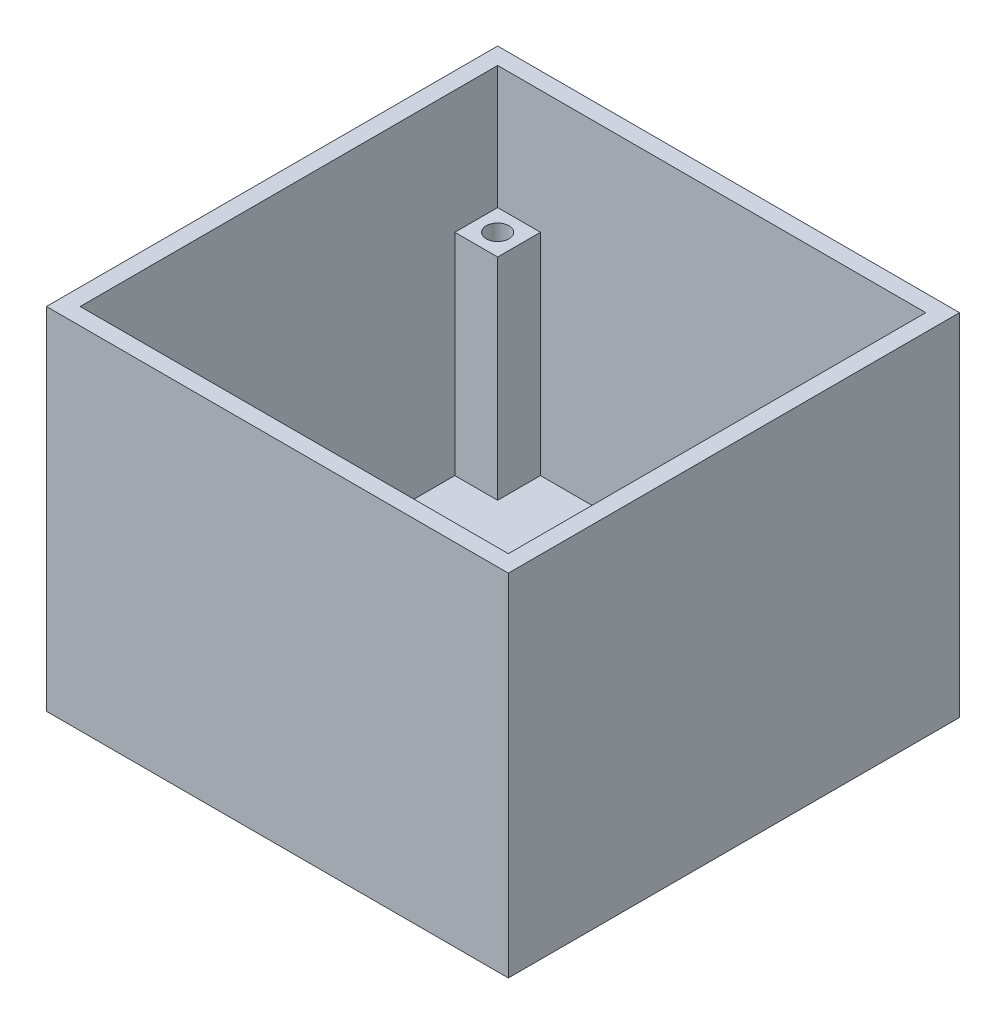
from build123d import *

# Parameters (mm, degrees)
SKETCH1_W           = 54.8
SKETCH1_H           = 53.53
BOSS_EXTRUDE1_DEPTH = 41.6
SKETCH2_W           = 50.8
SKETCH2_H           = 49.53
CUT_EXTRUDE1_DEPTH  = 39.6
SKETCH3_W           = 5.08
SKETCH3_H           = 5.08
BOSS_EXTRUDE2_DEPTH = 25
SKETCH4_R           = 1.35
CUT_EXTRUDE2_DEPTH  = 10


with BuildPart() as part:
    # Sketch1 → Boss-Extrude1 (new body)
    with BuildSketch(Plane(origin=(0, 0, 0), x_dir=(1, 0, 0), z_dir=(0, 1, 0))):
        Rectangle(SKETCH1_W, SKETCH1_H)
    extrude(amount=BOSS_EXTRUDE1_DEPTH)

    # Sketch2 → Cut-Extrude1 (cut)
    with BuildSketch(Plane(origin=(0, 41.6, 0), x_dir=(1, 0, 0), z_dir=(0, 1, 0))):
        Rectangle(SKETCH2_W, SKETCH2_H)
    extrude(amount=-CUT_EXTRUDE1_DEPTH, mode=Mode.SUBTRACT)

    # Sketch3 → Boss-Extrude2 (add)
    with BuildSketch(Plane(origin=(0, 2, 0), x_dir=(1, 0, 0), z_dir=(0, 1, 0))):
        with Locations((-22.86, 22.225)):
            Rectangle(SKETCH3_W, SKETCH3_H)
        with Locations((22.86, 22.225)):
            Rectangle(SKETCH3_W, SKETCH3_H)
        with Locations((22.86, -22.225)):
            Rectangle(SKETCH3_W, SKETCH3_H)
    extrude(amount=BOSS_EXTRUDE2_DEPTH)

    # Sketch4 → Cut-Extrude2 (cut)
    with BuildSketch(Plane(origin=(0, 27, 0), x_dir=(1, 0, 0), z_dir=(0, 1, 0))):
        with Locations((-22.86, 22.225)):
            Circle(SKETCH4_R)
        with Locations((22.86, 22.225)):
            Circle(SKETCH4_R)
        with Locations((22.86, -22.225)):
            Circle(SKETCH4_R)
    extrude(amount=-CUT_EXTRUDE2_DEPTH, mode=Mode.SUBTRACT)


solid = part.part
